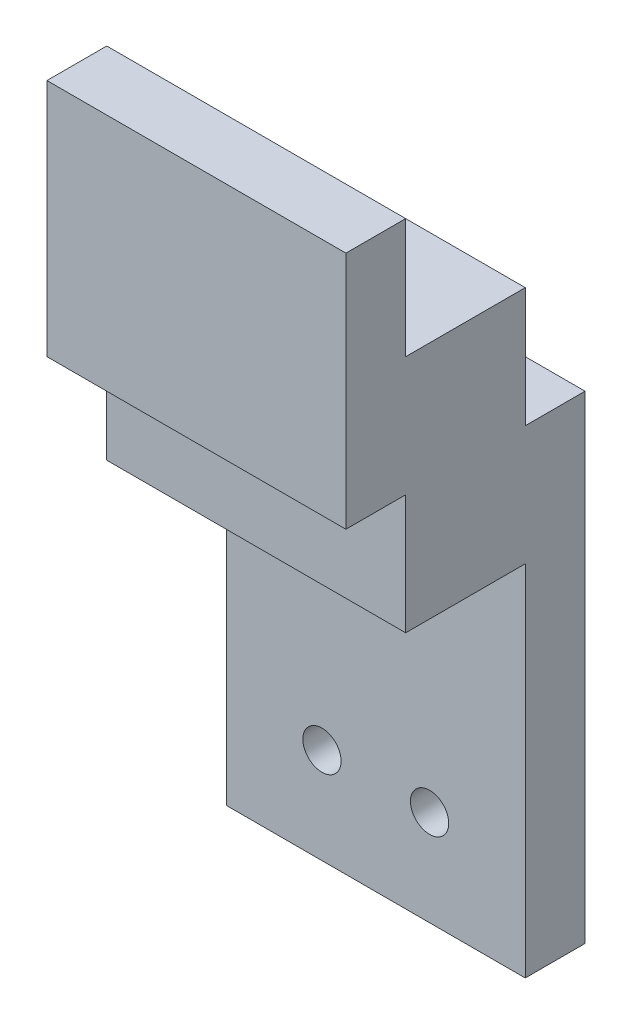
from build123d import *

# Parameters (mm, degrees)
SKETCH_1_W      = 25
SKETCH_1_H      = 40
SKETCH_1_R      = 1.6
EXTRUDE_1_DEPTH = 5
SKETCH_3_W      = 25
SKETCH_3_H      = 20
EXTRUDE_2_DEPTH = 10
SKETCH_4_W      = 25
SKETCH_4_H      = 20
EXTRUDE_3_DEPTH = 5


with BuildPart() as part:
    # 草图1 → 凸台-拉伸1 (new body)
    with BuildSketch(Plane.XY):
        with Locations((12.5, 20)):
            Rectangle(SKETCH_1_W, SKETCH_1_H)
        with Locations((8, 8)):
            Circle(SKETCH_1_R, mode=Mode.SUBTRACT)
        with Locations((17, 8)):
            Circle(SKETCH_1_R, mode=Mode.SUBTRACT)
    extrude(amount=EXTRUDE_1_DEPTH)

    # 草图3 → 凸台-拉伸2 (add)
    with BuildSketch(Plane.XY.offset(5)):
        with Locations((12.5, 40)):
            Rectangle(SKETCH_3_W, SKETCH_3_H)
    extrude(amount=EXTRUDE_2_DEPTH)

    # 草图4 → 凸台-拉伸3 (add)
    with BuildSketch(Plane.XY.offset(15)):
        with Locations((12.5, 50)):
            Rectangle(SKETCH_4_W, SKETCH_4_H)
    extrude(amount=EXTRUDE_3_DEPTH)


solid = part.part
